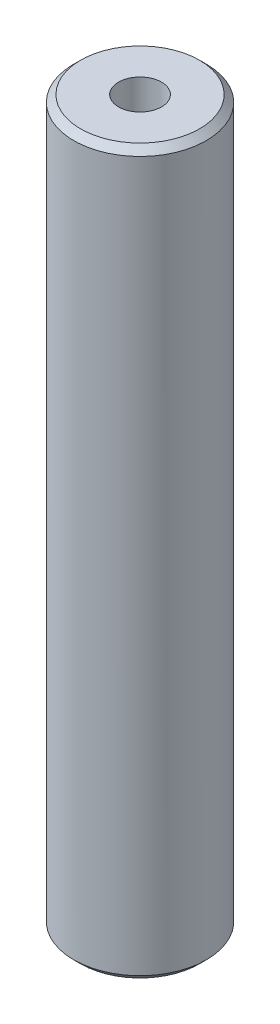
from build123d import *

# Parameters (mm, degrees)
SKETCH1_R           = 55
BOSS_EXTRUDE1_DEPTH = 600
SKETCH2_R           = 17.830265987
CUT_EXTRUDE1_DEPTH  = 606.020660804
CHAMFER1_SIZE       = 5.641814375


with BuildPart() as part:
    # Sketch1 → Boss-Extrude1 (new body)
    with BuildSketch(Plane(origin=(0, 0, 0), x_dir=(1, 0, 0), z_dir=(0, 1, 0))):
        Circle(SKETCH1_R)
    extrude(amount=BOSS_EXTRUDE1_DEPTH)

    # Sketch2 → Cut-Extrude1 (cut, through all)
    with BuildSketch(Plane(origin=(0, 0, 0), x_dir=(1, 0, 0), z_dir=(0, 1, 0))):
        Circle(SKETCH2_R)
    extrude(amount=CUT_EXTRUDE1_DEPTH, mode=Mode.SUBTRACT)

    # Chamfer1
    chamfer1_edges = [part.edges().sort_by_distance(p)[0] for p in [
        (-55, 600, 0),
        (-55, 0, 0),
    ]]
    chamfer(chamfer1_edges, length=CHAMFER1_SIZE)


solid = part.part
